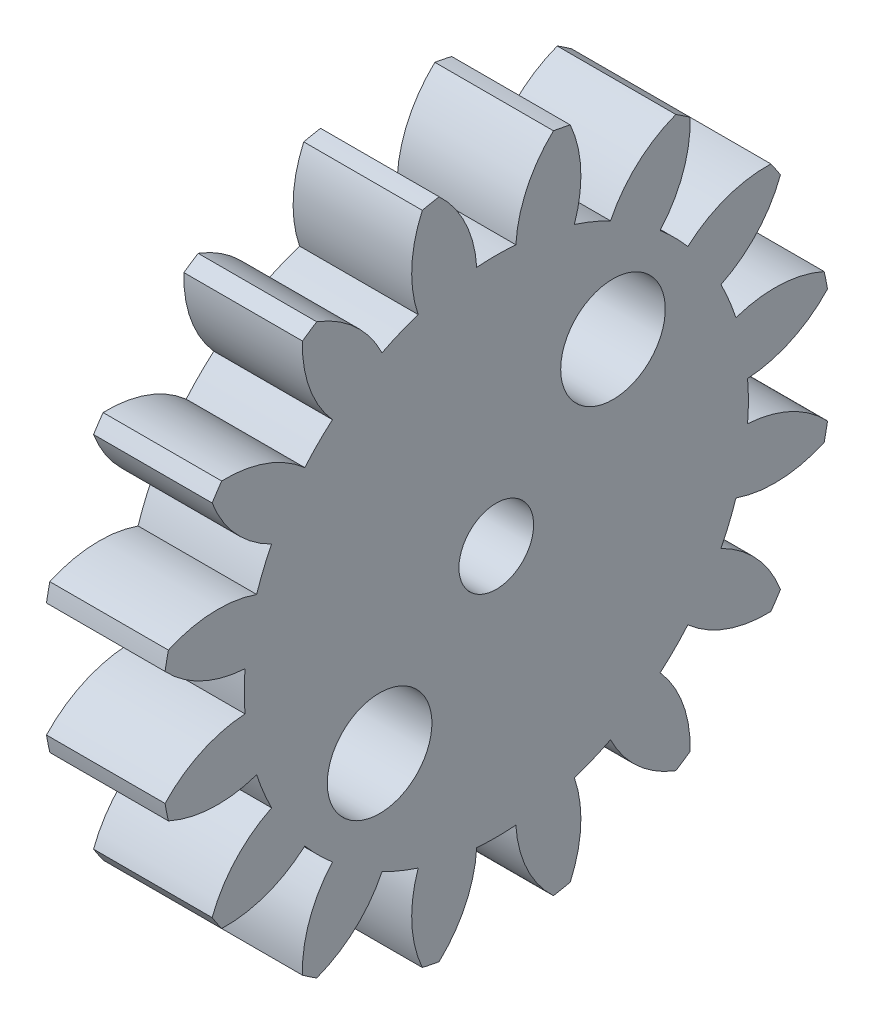
from build123d import *

# Parameters (mm, degrees)
BASPROSKE_W            = 3.175
BASPROSKE_H            = 9
TOOTHCUT_DEPTH         = 14.117950488
TEETHCUTS_COUNT        = 16
TEETHCUTS_ANGLE        = 337.5
BORSKE_R               = 1
BORE_DEPTH             = 50.0016256
CUT_EXTRUDE2_START     = -3.175
CUT_EXTRUDE2_OUTLINE_R = 1.4
CUT_EXTRUDE2_DEPTH     = 3.175


# Read off the part's stored shape, not the designer's step: Cut-Extrude2
with BuildPart() as part:
    # BasProSke → Base-Revolve (revolve)
    with BuildSketch(Plane(origin=(0, 0, 0), x_dir=(1, 0, 0), z_dir=(0, 1, 0)), mode=Mode.PRIVATE) as base_revolve_sk:
        with Locations((1.5875, 4.5)):
            Rectangle(BASPROSKE_W, BASPROSKE_H)
    revolve(base_revolve_sk.sketch.rotate(Axis((-10, 0, 0), (1, 0, 0)), 180), axis=Axis((-10, 0, 0), (1, 0, 0)))

    # TooCutSke → ToothCut (cut, through all)
    with BuildSketch(Plane(origin=(0, 0, 0), x_dir=(0, 0, -1), z_dir=(1, 0, 0))):
        with BuildLine():
            ThreePointArc((0.523792937, 6.728643397), (0, 6.749), (-0.523792937, 6.728643397))
            ThreePointArc((-0.523792937, 6.728643397), (-0.828704482, 7.90962059), (-1.553355277, 8.890721711))
            ThreePointArc((-1.553355277, 8.890721711), (0, 9.0254), (1.553355277, 8.890721711))
            ThreePointArc((1.553355277, 8.890721711), (0.828704482, 7.90962059), (0.523792937, 6.728643397))
        make_face()
    toothcut = extrude(amount=TOOTHCUT_DEPTH, mode=Mode.SUBTRACT)

    # TeethCuts: ToothCut ×16 about axis
    teethcuts_axis = Axis((-10, 0, 0), (1, 0, 0))
    for i in range(1, TEETHCUTS_COUNT):
        add(toothcut.rotate(teethcuts_axis, i * TEETHCUTS_ANGLE / (TEETHCUTS_COUNT - 1)), mode=Mode.SUBTRACT)

    # BorSke → Bore (cut, symmetric)
    with BuildSketch(Plane(origin=(0, 0, 0), x_dir=(0, 0, -1), z_dir=(1, 0, 0))):
        with Locations(Location((0, 0, 0), (0, 0, 180))):
            Circle(BORSKE_R)
    extrude(amount=BORE_DEPTH, both=True, mode=Mode.SUBTRACT)

    # Cut-Extrude2 outline → Cut-Extrude2 (cut)
    with BuildSketch(Plane(origin=(0, 0.498479729, -127.163742786), x_dir=(0, -0.6257802276580691, -0.779999427353774), z_dir=(-1, 0, 0)).offset(CUT_EXTRUDE2_START)):
        with Locations((-98.465111461, 75.484141115)):
            Circle(CUT_EXTRUDE2_OUTLINE_R)
        with Locations((-99.286304129, 84.446598512)):
            Circle(CUT_EXTRUDE2_OUTLINE_R)
    extrude(amount=CUT_EXTRUDE2_DEPTH, mode=Mode.SUBTRACT)


solid = part.part
